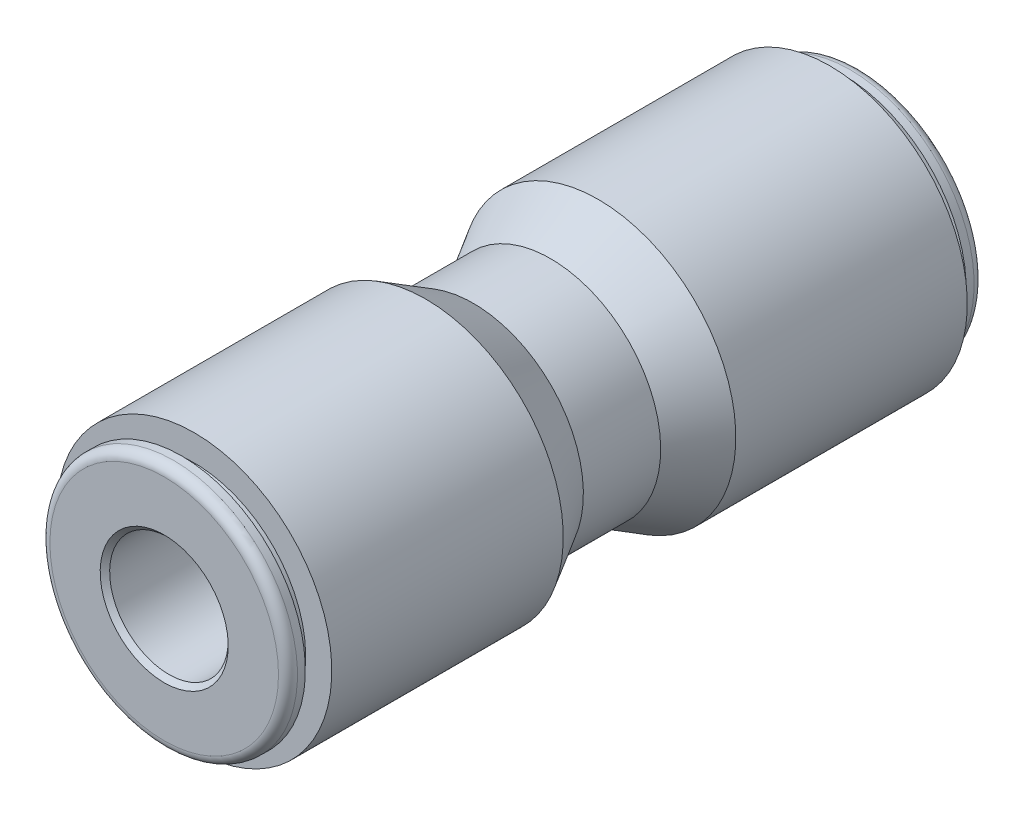
from build123d import *


with BuildPart() as part:
    # Sketch1 → Revolve1 (revolve)
    with BuildSketch(Plane(origin=(0, 0, 0), x_dir=(0, 0, -1), z_dir=(1, 0, 0))):
        with BuildLine():
            Line((26.543, 9.9441), (27.178, 9.9441))
            ThreePointArc((27.178, 9.9441), (27.716815367, 9.720915367), (27.94, 9.1821))
            Line((27.94, 9.1821), (27.94, 6.731))
            Line((27.94, 6.731), (27.559, 6.35))
            Line((27.559, 6.35), (0.254, 6.35))
            Line((0.254, 6.35), (0.254, 3.175))
            Line((0.254, 3.175), (-7.112, 3.175))
            Line((-7.112, 3.175), (-7.112, 4.7625))
            Line((-7.112, 4.7625), (-27.559, 4.7625))
            Line((-27.559, 4.7625), (-27.94, 5.1435))
            Line((-27.94, 5.1435), (-27.94, 9.1821))
            ThreePointArc((-27.94, 9.1821), (-27.716815367, 9.720915367), (-27.178, 9.9441))
            Line((-27.178, 9.9441), (-26.543, 9.9441))
            Line((-26.543, 9.9441), (-26.543, 8.94969))
            Line((-26.543, 8.94969), (-25.527, 8.94969))
            Line((-25.527, 8.94969), (-25.527, 11.049))
            Line((-25.527, 11.049), (-6.931930319, 11.049))
            Line((-6.931930319, 11.049), (-3.104444444, 8.8392))
            Line((-3.104444444, 8.8392), (3.104444444, 8.8392))
            Line((3.104444444, 8.8392), (6.931930319, 11.049))
            Line((6.931930319, 11.049), (25.527, 11.049))
            Line((25.527, 11.049), (25.527, 8.94969))
            Line((25.527, 8.94969), (26.543, 8.94969))
            Line((26.543, 8.94969), (26.543, 9.9441))
        make_face()
    revolve(axis=Axis((0, 0, 0), (0, 0, -1)))


solid = part.part
